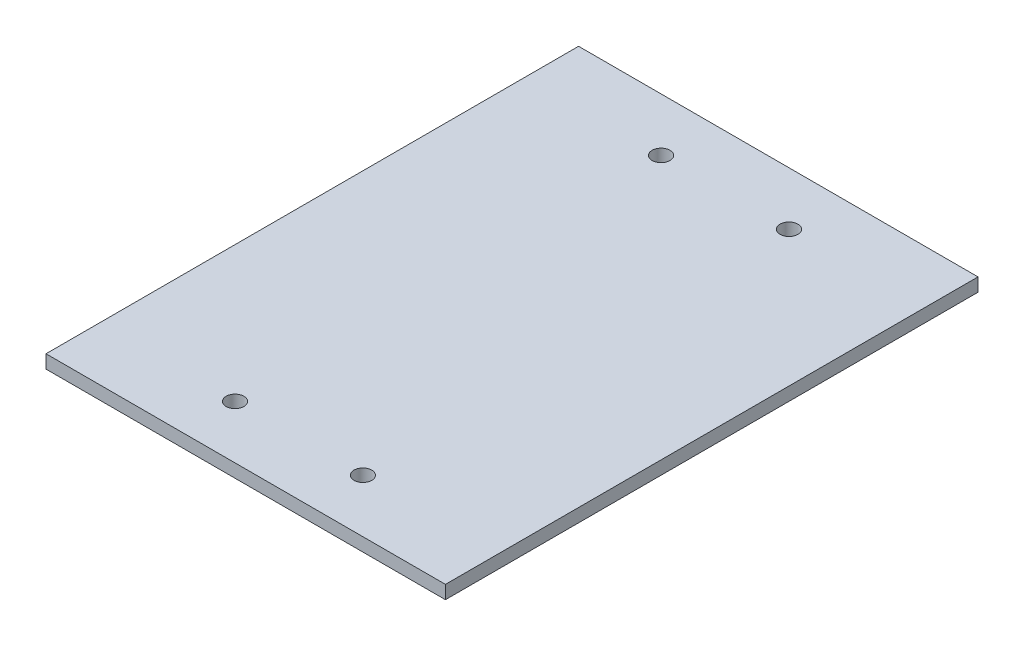
from build123d import *

# Parameters (mm, degrees)
SKETCH1_W           = 76.2
SKETCH1_H           = 101.6
SKETCH1_R           = 1.7
BOSS_EXTRUDE1_DEPTH = 2.54


with BuildPart() as part:
    # Sketch1 → Boss-Extrude1 (new body)
    with BuildSketch(Plane(origin=(0, 0, 0), x_dir=(1, 0, 0), z_dir=(0, 1, 0))):
        Rectangle(SKETCH1_W, SKETCH1_H)
        with Locations((-12.2, 40.64)):
            Circle(SKETCH1_R, mode=Mode.SUBTRACT)
        with Locations((12.2, 40.64)):
            Circle(SKETCH1_R, mode=Mode.SUBTRACT)
        with Locations((12.2, -40.64)):
            Circle(SKETCH1_R, mode=Mode.SUBTRACT)
        with Locations((-12.2, -40.64)):
            Circle(SKETCH1_R, mode=Mode.SUBTRACT)
    extrude(amount=BOSS_EXTRUDE1_DEPTH)


solid = part.part
